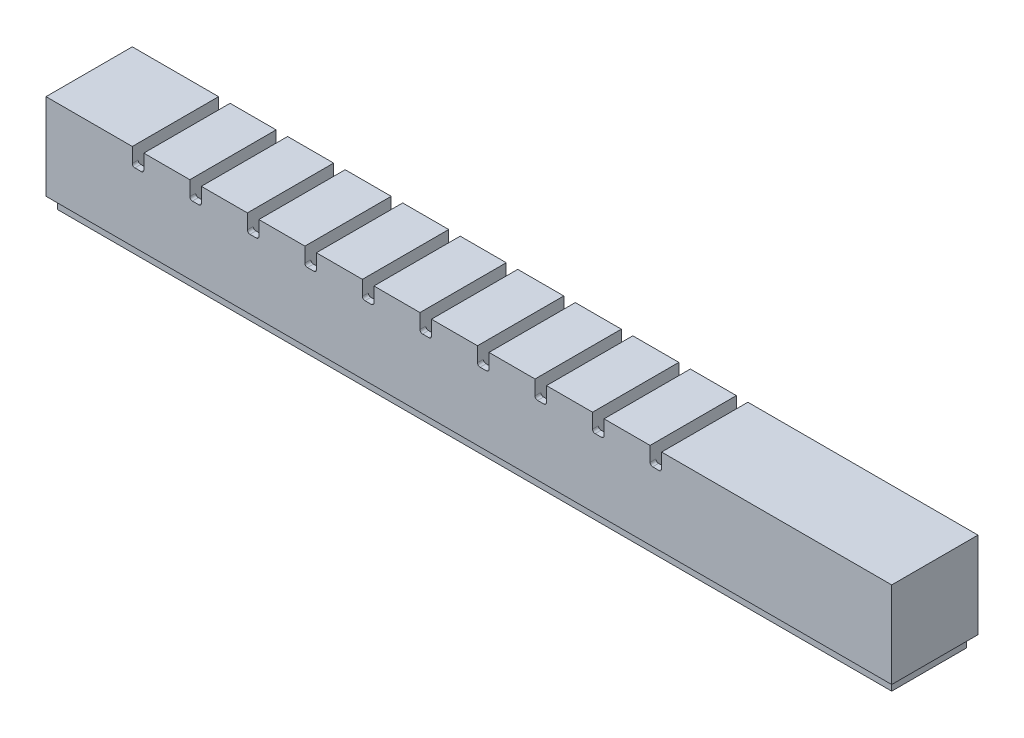
from build123d import *

# Parameters (mm, degrees)
SKETCH1_W                       = 8
SKETCH1_H                       = 15
FIRST_CHAMBER_BLOCK_DEPTH       = 15
SKETCH2_W                       = 6
SKETCH2_H                       = 11
FIRST_CHAMBER_CAVITY_DEPTH      = 13
SKETCH3_W                       = 15
SKETCH3_H                       = 3
CHAMBER_SPACER_DEPTH            = 2
PATTERN_CHAMBERS_COUNT          = 11
PATTERN_CHAMBERS_PITCH          = 10
SKETCH4_W                       = 15
SKETCH4_H                       = 12
THICKEN_END_1_DEPTH             = 2
SKETCH5_W                       = 15
SKETCH5_H                       = 15
THICKEN_END_2_DEPTH             = 2
SKETCH6_W                       = 94
SKETCH6_H                       = 2
CENTRAL_AIR_CHANNEL_DEPTH       = 2
AUFSATZ_LINEAR_AUSTRAGEN3_REACH = 106.183
SCHNITT_LINEAR_AUSTRAGEN2_DEPTH = 113.026782512
LINEARES_MUSTER8_COUNT          = 10
LINEARES_MUSTER8_PITCH          = 10
SKETCH17_W                      = 15
SKETCH17_H                      = 15
BOSS_EXTRUDE1_DEPTH             = 30
SKETCH18_W                      = 15
SKETCH18_H                      = 15
BOSS_EXTRUDE2_DEPTH             = 5
CUT_EXTRUDE1_DEPTH              = 12
SKETCH20_W                      = 2
SKETCH20_H                      = 2
SKETCH20_W_2                    = 1.671572875
SKETCH20_R                      = 1
NIPPLE_EXTRUDE_DEPTH            = 2


with BuildPart() as part:
    # Sketch1 → first chamber block (new body)
    with BuildSketch(Plane.XY):
        with Locations((4, 7.5)):
            Rectangle(SKETCH1_W, SKETCH1_H)
    extrude(amount=FIRST_CHAMBER_BLOCK_DEPTH)

    # Sketch2 → first chamber cavity (cut)
    with BuildSketch(Plane.XZ):
        with Locations((4, 7.5)):
            Rectangle(SKETCH2_W, SKETCH2_H)
    extrude(amount=-FIRST_CHAMBER_CAVITY_DEPTH, mode=Mode.SUBTRACT)

    # Sketch3 → chamber spacer (add)
    with BuildSketch(Plane(origin=(8, 0, 0), x_dir=(0, 0, -1), z_dir=(1, 0, 0))):
        with Locations((-7.5, 1.5)):
            Rectangle(SKETCH3_W, SKETCH3_H)
    extrude(amount=CHAMBER_SPACER_DEPTH)


with BuildPart() as pattern_chambers_1:
    # pattern chambers: pattern copy
    add(part.part.moved(Location(Vector(1, 0, 0) * (1 * PATTERN_CHAMBERS_PITCH))))


with BuildPart() as pattern_chambers_2:
    # pattern chambers: pattern copy
    add(part.part.moved(Location(Vector(1, 0, 0) * (2 * PATTERN_CHAMBERS_PITCH))))


with BuildPart() as pattern_chambers_3:
    # pattern chambers: pattern copy
    add(part.part.moved(Location(Vector(1, 0, 0) * (3 * PATTERN_CHAMBERS_PITCH))))


with BuildPart() as pattern_chambers_4:
    # pattern chambers: pattern copy
    add(part.part.moved(Location(Vector(1, 0, 0) * (4 * PATTERN_CHAMBERS_PITCH))))


with BuildPart() as pattern_chambers_5:
    # pattern chambers: pattern copy
    add(part.part.moved(Location(Vector(1, 0, 0) * (5 * PATTERN_CHAMBERS_PITCH))))


with BuildPart() as pattern_chambers_6:
    # pattern chambers: pattern copy
    add(part.part.moved(Location(Vector(1, 0, 0) * (6 * PATTERN_CHAMBERS_PITCH))))


with BuildPart() as pattern_chambers_7:
    # pattern chambers: pattern copy
    add(part.part.moved(Location(Vector(1, 0, 0) * (7 * PATTERN_CHAMBERS_PITCH))))


with BuildPart() as pattern_chambers_8:
    # pattern chambers: pattern copy
    add(part.part.moved(Location(Vector(1, 0, 0) * (8 * PATTERN_CHAMBERS_PITCH))))


with BuildPart() as pattern_chambers_9:
    # pattern chambers: pattern copy
    add(part.part.moved(Location(Vector(1, 0, 0) * (9 * PATTERN_CHAMBERS_PITCH))))


with BuildPart() as pattern_chambers_10:
    # pattern chambers: pattern copy
    add(part.part.moved(Location(Vector(1, 0, 0) * (10 * PATTERN_CHAMBERS_PITCH))))

    # combine into 1 solid body: union pattern chambers_9, pattern chambers_8, pattern chambers_7, pattern chambers_6, pattern chambers_5, pattern chambers_4, pattern chambers_3, pattern chambers_2, pattern chambers_1, part
    add(pattern_chambers_9.part)
    add(pattern_chambers_8.part)
    add(pattern_chambers_7.part)
    add(pattern_chambers_6.part)
    add(pattern_chambers_5.part)
    add(pattern_chambers_4.part)
    add(pattern_chambers_3.part)
    add(pattern_chambers_2.part)
    add(pattern_chambers_1.part)
    add(part.part)

    # Sketch4 → thicken end 1 (add)
    with BuildSketch(Plane(origin=(108, 0, 0), x_dir=(0, 0, -1), z_dir=(1, 0, 0))):
        with Locations((-7.5, 9)):
            Rectangle(SKETCH4_W, SKETCH4_H)
    extrude(amount=THICKEN_END_1_DEPTH)

    # Sketch5 → thicken end 2 (add)
    with BuildSketch(Plane.ZY):
        with Locations((7.5, 7.5)):
            Rectangle(SKETCH5_W, SKETCH5_H)
    extrude(amount=THICKEN_END_2_DEPTH)

    # Sketch6 → central air channel (cut)
    with BuildSketch(Plane.XZ):
        with Locations((54, 7.5)):
            Rectangle(SKETCH6_W, SKETCH6_H)
    extrude(amount=-CENTRAL_AIR_CHANNEL_DEPTH, mode=Mode.SUBTRACT)

    # Skizze3 → Aufsatz-Linear austragen3 (add, up to next)
    with BuildSketch(Plane(origin=(8, 0, 0), x_dir=(0, 0, -1), z_dir=(1, 0, 0)), mode=Mode.PRIVATE) as aufsatz_linear_austragen3_sk1:
        Polygon((-15, 3), (-13.5, 3), (-14, 12.5), (-15, 12.5), align=None)
    aufsatz_linear_austragen3_tool1 = extrude(aufsatz_linear_austragen3_sk1.sketch, amount=AUFSATZ_LINEAR_AUSTRAGEN3_REACH, mode=Mode.PRIVATE) - pattern_chambers_10.part
    # Skizze3 → Aufsatz-Linear austragen3 (add, up to next)
    with BuildSketch(Plane(origin=(8, 0, 0), x_dir=(0, 0, -1), z_dir=(1, 0, 0)), mode=Mode.PRIVATE) as aufsatz_linear_austragen3_sk2:
        Polygon((0, 12.5), (0, 3), (-1.5, 3), (-1, 12.5), align=None)
    aufsatz_linear_austragen3_tool2 = extrude(aufsatz_linear_austragen3_sk2.sketch, amount=AUFSATZ_LINEAR_AUSTRAGEN3_REACH, mode=Mode.PRIVATE) - pattern_chambers_10.part
    aufsatz_linear_austragen3_1 = aufsatz_linear_austragen3_tool1.solids().sort_by_distance((8, 7.433333, 14.366667))[0]
    add(aufsatz_linear_austragen3_1)
    aufsatz_linear_austragen3_2 = aufsatz_linear_austragen3_tool2.solids().sort_by_distance((8, 7.433333, 0.633333))[0]
    add(aufsatz_linear_austragen3_2)
    aufsatz_linear_austragen3 = aufsatz_linear_austragen3_1 + aufsatz_linear_austragen3_2  # Aufsatz-Linear austragen3 as one shape, for the pattern or mirror that repeats it

    # Skizze5 → Schnitt-Linear austragen2 (cut, through all)
    with BuildSketch(Plane(origin=(0, 0, 0), x_dir=(-1, 0, 0), z_dir=(0, 0, -1))):
        with BuildLine():
            Line((-10, 12.5), (-8, 12.5))
            Line((-8, 12.5), (-8, 12.45))
            ThreePointArc((-8, 12.45), (-8.131801948, 12.131801948), (-8.45, 12))
            Line((-8.45, 12), (-9.55, 12))
            ThreePointArc((-9.55, 12), (-9.868198052, 12.131801948), (-10, 12.45))
            Line((-10, 12.45), (-10, 12.5))
        make_face()
    schnitt_linear_austragen2 = extrude(amount=-SCHNITT_LINEAR_AUSTRAGEN2_DEPTH, mode=Mode.SUBTRACT)

    # Lineares Muster8: Aufsatz-Linear austragen3, Schnitt-Linear austragen2 ×10
    with Locations(*[(i * LINEARES_MUSTER8_PITCH, 0, 0) for i in range(1, LINEARES_MUSTER8_COUNT)]):
        add(aufsatz_linear_austragen3)
        add(schnitt_linear_austragen2, mode=Mode.SUBTRACT)

    # Sketch17 → Boss-Extrude1 (add)
    with BuildSketch(Plane(origin=(110, 0, 0), x_dir=(0, 0, -1), z_dir=(1, 0, 0))):
        with Locations((-7.5, 7.5)):
            Rectangle(SKETCH17_W, SKETCH17_H)
    extrude(amount=BOSS_EXTRUDE1_DEPTH)

    # Sketch18 → Boss-Extrude2 (add)
    with BuildSketch(Plane.ZY.offset(2)):
        with Locations((7.5, 7.5)):
            Rectangle(SKETCH18_W, SKETCH18_H)
    extrude(amount=BOSS_EXTRUDE2_DEPTH)

    # Sketch19 → Cut-Extrude1 (cut)
    with BuildSketch(Plane.XZ):
        Polygon((131.828427125, 7.5), (137.328427125, 2), (137.328427125, 13), align=None)
        Polygon((126.328427125, 2), (134.5, 2), (130.414213562, 6.085786438), align=None)
        Polygon((130.414213562, 8.914213562), (134.5, 13), (126.328427125, 13), align=None)
        Polygon((112.5, 2), (120.671572875, 2), (116.585786438, 6.085786438), align=None)
        Polygon((118, 7.5), (122.5, 3), (122.5, 12), align=None)
        Polygon((124.5, 12), (124.5, 3), (129, 7.5), align=None)
        Polygon((116.585786438, 8.914213562), (120.671572875, 13), (112.5, 13), align=None)
        Polygon((109.671572875, 13), (109.671572875, 2), (115.171572875, 7.5), align=None)
    extrude(amount=-CUT_EXTRUDE1_DEPTH, mode=Mode.SUBTRACT)

    # Sketch20 → nipple_extrude (add)
    with BuildSketch(Plane.XZ):
        Polygon((-6, 13), (-5, 13), (5, 13), (8, 13), (10, 13), (15, 13), (25, 13), (35, 13), (45, 13), (55, 13), (65, 13), (75, 13), (85, 13), (128, 13), (138, 13), (139, 13), (139, 14), (-6, 14), align=None)
        Polygon((-5, 2), (-5, 13), (-6, 13), (-6, 1), (139, 1), (139, 13), (138, 13), (138, 2), align=None)
        with Locations((-1, 10.5)):
            Rectangle(SKETCH20_W, SKETCH20_H)
        with Locations((-1, 4.5)):
            Rectangle(SKETCH20_W, SKETCH20_H)
        with Locations((9, 10.5)):
            Rectangle(SKETCH20_W, SKETCH20_H)
        with Locations((9, 4.5)):
            Rectangle(SKETCH20_W, SKETCH20_H)
        with Locations((19, 10.5)):
            Rectangle(SKETCH20_W, SKETCH20_H)
        with Locations((19, 4.5)):
            Rectangle(SKETCH20_W, SKETCH20_H)
        with Locations((29, 4.5)):
            Rectangle(SKETCH20_W, SKETCH20_H)
        with Locations((29, 10.5)):
            Rectangle(SKETCH20_W, SKETCH20_H)
        with Locations((39, 10.5)):
            Rectangle(SKETCH20_W, SKETCH20_H)
        with Locations((39, 4.5)):
            Rectangle(SKETCH20_W, SKETCH20_H)
        with Locations((49, 10.5)):
            Rectangle(SKETCH20_W, SKETCH20_H)
        with Locations((49, 4.5)):
            Rectangle(SKETCH20_W, SKETCH20_H)
        with Locations((59, 4.5)):
            Rectangle(SKETCH20_W, SKETCH20_H)
        with Locations((59, 10.5)):
            Rectangle(SKETCH20_W, SKETCH20_H)
        with Locations((69, 10.5)):
            Rectangle(SKETCH20_W, SKETCH20_H)
        with Locations((69, 4.5)):
            Rectangle(SKETCH20_W, SKETCH20_H)
        with Locations((79, 10.5)):
            Rectangle(SKETCH20_W, SKETCH20_H)
        with Locations((79, 4.5)):
            Rectangle(SKETCH20_W, SKETCH20_H)
        with Locations((89, 10.5)):
            Rectangle(SKETCH20_W, SKETCH20_H)
        with Locations((89, 4.5)):
            Rectangle(SKETCH20_W, SKETCH20_H)
        with Locations((99, 10.5)):
            Rectangle(SKETCH20_W, SKETCH20_H)
        with Locations((99, 4.5)):
            Rectangle(SKETCH20_W, SKETCH20_H)
        with Locations((108.335786438, 4.5)):
            Rectangle(SKETCH20_W_2, SKETCH20_H)
        with Locations((108.335786438, 10.5)):
            Rectangle(SKETCH20_W_2, SKETCH20_H)
        with Locations(Location((116.585786438, 7.5, 0), (0, 0, 90))):
            Circle(SKETCH20_R)
        with Locations(Location((130.414213562, 7.5, 0), (0, 0, 90))):
            Circle(SKETCH20_R)
    extrude(amount=NIPPLE_EXTRUDE_DEPTH)


solid = pattern_chambers_10.part
